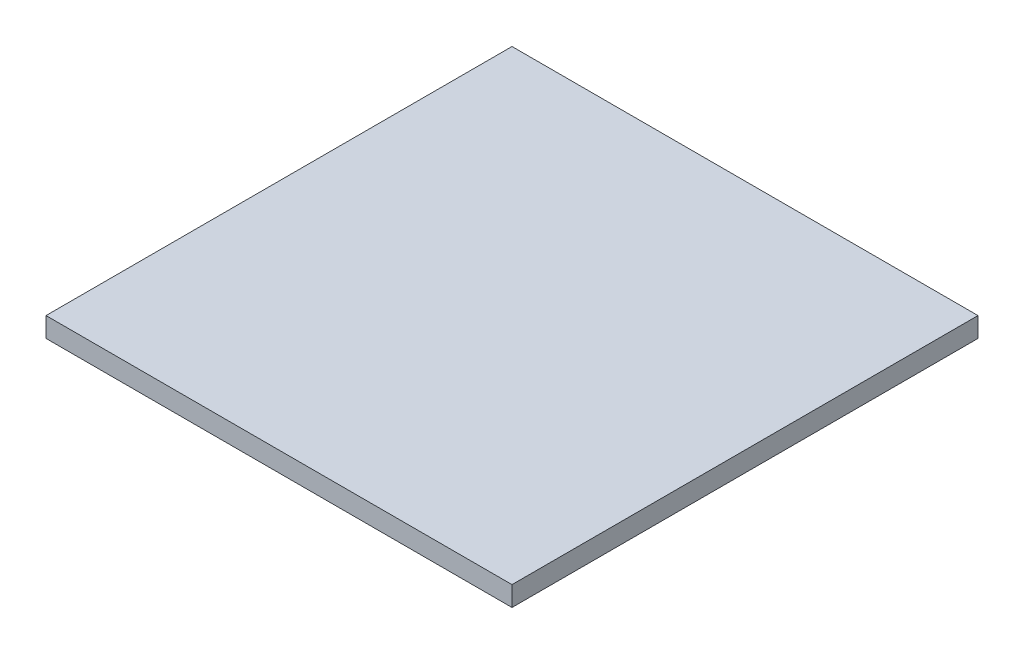
from build123d import *

# Parameters (mm, degrees)
SKETCH1_W           = 94
SKETCH1_H           = 94
BOSS_EXTRUDE1_DEPTH = 4


with BuildPart() as part:
    # Sketch1 → Boss-Extrude1 (new body)
    with BuildSketch(Plane(origin=(0, 0, 0), x_dir=(1, 0, 0), z_dir=(0, 1, 0))):
        Rectangle(SKETCH1_W, SKETCH1_H)
    extrude(amount=BOSS_EXTRUDE1_DEPTH)


solid = part.part
